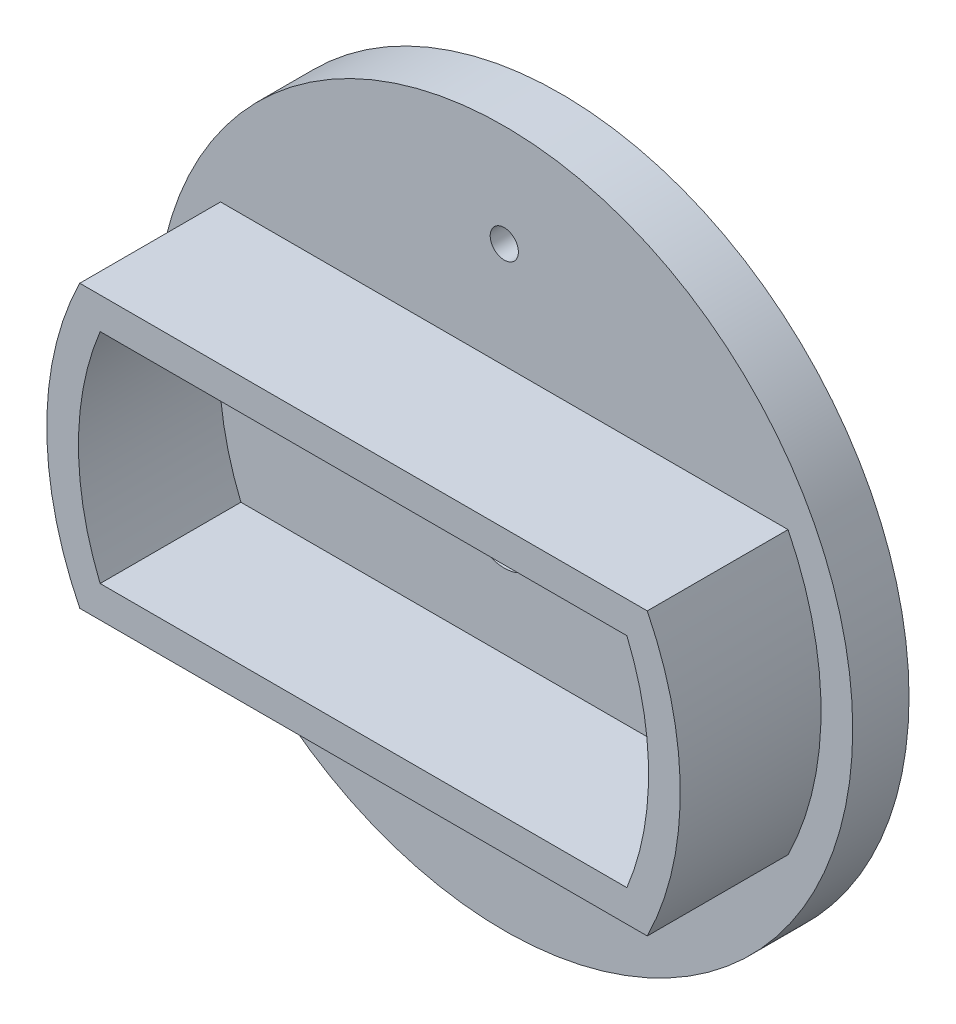
from build123d import *

# Parameters (mm, degrees)
SKETCH2_R           = 49.5
BOSS_EXTRUDE1_DEPTH = 8
SKETCH1_R           = 4.9
CUT_EXTRUDE1_DEPTH  = 29
BOSS_EXTRUDE2_DEPTH = 20
SKETCH1_14_R        = 2
CUT_EXTRUDE5_DEPTH  = 31


with BuildPart() as part:
    # Sketch2 → Boss-Extrude1 (new body)
    with BuildSketch(Plane.XY):
        Circle(SKETCH2_R)
    extrude(amount=BOSS_EXTRUDE1_DEPTH)

    # Sketch1 → Cut-Extrude1 (cut)
    with BuildSketch(Plane(origin=(0, 0, 0), x_dir=(-1, 0, 0), z_dir=(0, 0, 1))):
        Circle(SKETCH1_R)
    extrude(amount=CUT_EXTRUDE1_DEPTH, mode=Mode.SUBTRACT)

    # Sketch4 → Boss-Extrude2 (add)
    with BuildSketch(Plane.XY.offset(8)):
        with BuildLine():
            Line((-40.311288741, -20), (40.311288741, -20))
            ThreePointArc((40.311288741, -20), (45, 0), (40.311288741, 20))
            Line((40.311288741, 20), (-40.311288741, 20))
            ThreePointArc((-40.311288741, 20), (-45, 0), (-40.311288741, -20))
        make_face()
        with BuildLine():
            ThreePointArc((-37.416573868, -15.5), (-40.5, 0), (-37.416573868, 15.5))
            Line((-37.416573868, 15.5), (37.416573868, 15.5))
            ThreePointArc((37.416573868, 15.5), (40.5, 0), (37.416573868, -15.5))
            Line((37.416573868, -15.5), (-37.416573868, -15.5))
        make_face(mode=Mode.SUBTRACT)
    extrude(amount=BOSS_EXTRUDE2_DEPTH)

    # Sketch1<14> → Cut-Extrude5 (cut)
    with BuildSketch(Plane(origin=(0, 0, 0), x_dir=(-1, 0, 0), z_dir=(0, 0, 1))):
        with Locations((0, -35)):
            Circle(SKETCH1_14_R)
        with Locations((0, 35)):
            Circle(SKETCH1_14_R)
    extrude(amount=CUT_EXTRUDE5_DEPTH, mode=Mode.SUBTRACT)


solid = part.part
